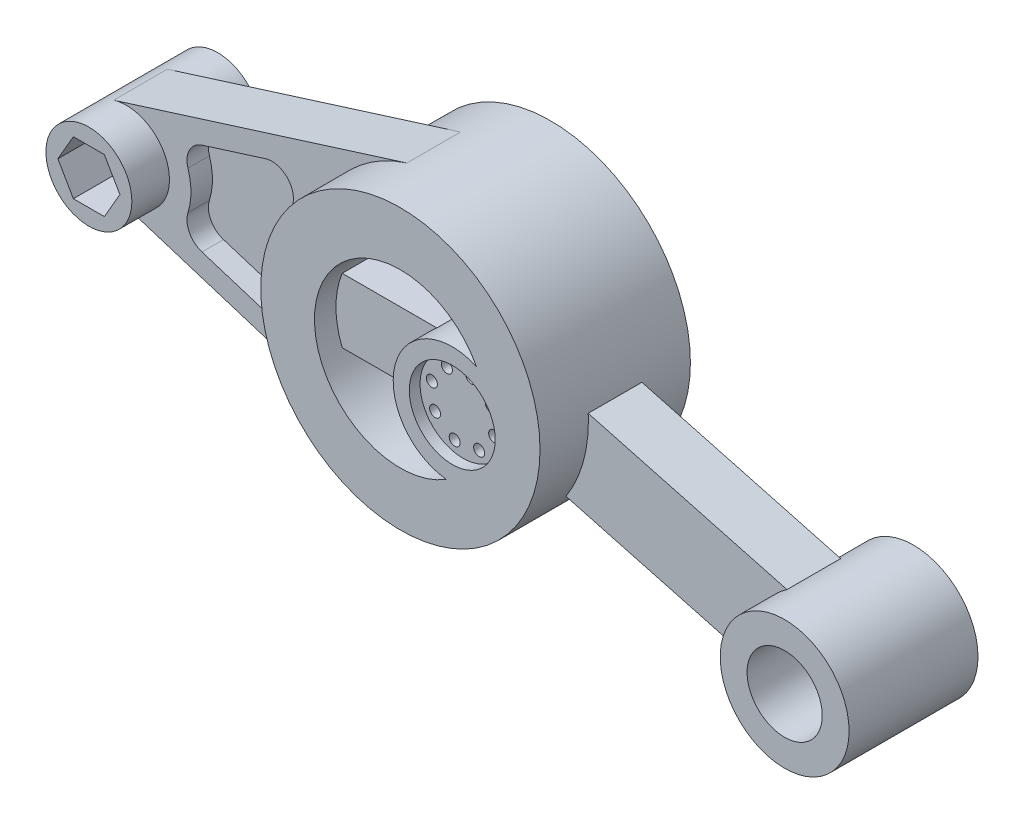
from build123d import *
from build123d.topology import SkipClean

# Parameters (mm, degrees)
LEFT_ARM_DEPTH                = 12.5
SKETCH2_R                     = 20
LEFT_BOSS_DEPTH               = 30
LEFT_HEX_DEPTH                = 233.486558751
LEFT_HEX_DEPTH_BACK           = 233.486558751
SKETCH3_R                     = 65
CENTRE_BOSS_DEPTH             = 35
SKETCH5_W                     = 25
SKETCH5_H                     = 40
RIGHT_ARM_DEPTH               = 180
SKETCH7_R                     = 30
RIGHT_BOSS_DEPTH              = 30
SKETCH8_R                     = 17.5
RIGHT_BOSS_HOLE_DEPTH         = 368.848119787
SKETCH9_R                     = 40
CENTRE_HOLE_DEPTH             = 369.764476639
SKETCH10_R                    = 27.5
CENTRE_BLOB_DEPTH             = 35
CENTRE_BEAM_REACH             = 222.573
SKETCH11_W                    = 50
SKETCH11_H                    = 30
CENTRE_BEAM_DIRECTION_2_REACH = 222.573
SKETCH12_R                    = 20
CUT_EXTRUDE4_DEPTH            = 5
F_1_4_20_TAPPED_HOLE1_D       = 5.1054
CIRPATTERN1_COUNT             = 8
CUT_OUT_DEPTH                 = 10
FILLET1_R                     = 10
FILLET1_OF_MIRROR2_R          = 10


with BuildPart() as part:
    # Sketch1 → LEFT_ARM (new, symmetric)
    with BuildSketch(Plane.XY):
        with BuildLine():
            Line((-6, 19.078784028), (130.5, 62.006048092))
            ThreePointArc((130.5, 62.006048092), (215, 0), (130.5, -62.006048092))
            Line((130.5, -62.006048092), (-6, -19.078784028))
            ThreePointArc((-6, -19.078784028), (-20, 0), (-6, 19.078784028))
        make_face()
    extrude(amount=LEFT_ARM_DEPTH, both=True)

    # Sketch2 → LEFT_Boss (add, symmetric)
    with SkipClean():  # the faces are left unmerged after this step: merging them gives an invalid solid
        with BuildSketch(Plane.XY):
            Circle(SKETCH2_R)
        extrude(amount=LEFT_BOSS_DEPTH, both=True)

    # Sketch4 → LEFT_Hex (cut, two sides: drawn at the far end of the back side and taken through both)
    with SkipClean():  # the faces are left unmerged after this step: merging them gives an invalid solid
        with BuildSketch(Plane.XY.offset(30).offset(-LEFT_HEX_DEPTH_BACK)):
            Polygon((14.43375673, 0), (7.216878365, 12.5), (-7.216878365, 12.5), (-14.43375673, 0), (-7.216878365, -12.5), (7.216878365, -12.5), align=None)
        extrude(amount=LEFT_HEX_DEPTH + LEFT_HEX_DEPTH_BACK, mode=Mode.SUBTRACT)

    # Sketch3 → CENTRE_Boss (add, symmetric)
    with SkipClean():  # the faces are left unmerged after this step: merging them gives an invalid solid
        with BuildSketch(Plane.XY):
            with Locations((150, 0)):
                Circle(SKETCH3_R)
        extrude(amount=CENTRE_BOSS_DEPTH, both=True)

    # Sketch5 → RIGHT_ARM (add)
    with SkipClean():  # the faces are left unmerged after this step: merging them gives an invalid solid
        with BuildSketch(Plane(origin=(139.951905284, -37.5, 0), x_dir=(0, 0, -1), z_dir=(0.9659258262890681, -0.25881904510252135, 0))):
            with Locations((0, 38.822856765)):
                Rectangle(SKETCH5_W, SKETCH5_H)
        extrude(amount=RIGHT_ARM_DEPTH)

    # Sketch7 → RIGHT_Boss (add, symmetric)
    with SkipClean():  # the faces are left unmerged after this step: merging them gives an invalid solid
        with BuildSketch(Plane.XY):
            with Locations((323.866648732, -46.587428118)):
                Circle(SKETCH7_R)
        extrude(amount=RIGHT_BOSS_DEPTH, both=True)
    add(part.part.scale(1), mode=Mode.REPLACE)  # the faces are merged on a copy

    # Sketch8 → RIGHT_Boss_Hole (cut, through all)
    with BuildSketch(Plane.XY.offset(30)):
        with Locations((323.866648732, -46.587428118)):
            Circle(SKETCH8_R)
    extrude(amount=-RIGHT_BOSS_HOLE_DEPTH, mode=Mode.SUBTRACT)

    # Sketch9 → CENTRE_Hole (cut, through all)
    with BuildSketch(Plane.XY.offset(35)):
        with Locations((150, 0)):
            Circle(SKETCH9_R)
    extrude(amount=-CENTRE_HOLE_DEPTH, mode=Mode.SUBTRACT)

    # Sketch10 → CENTRE_Blob (add, symmetric)
    with SkipClean():  # the faces are left unmerged after this step: merging them gives an invalid solid
        with BuildSketch(Plane.XY):
            with Locations((174.148145657, -6.470476128)):
                Circle(SKETCH10_R)
        extrude(amount=CENTRE_BLOB_DEPTH, both=True)

    # Sketch11 → CENTRE_Beam (add, up to next)
    with BuildSketch(Plane(origin=(150, 0, 0), x_dir=(0, 0, -1), z_dir=(1, 0, 0)), mode=Mode.PRIVATE) as centre_beam_sk1:
        Rectangle(SKETCH11_W, SKETCH11_H)
    centre_beam_tool1 = extrude(centre_beam_sk1.sketch, amount=CENTRE_BEAM_REACH, mode=Mode.PRIVATE) - part.part
    add(centre_beam_tool1.solids().sort_by_distance((150, 0, 0))[0])

    # Sketch11 → CENTRE_Beam direction 2 (add, up to next)
    with BuildSketch(Plane(origin=(150, 0, 0), x_dir=(0, 0, -1), z_dir=(1, 0, 0)), mode=Mode.PRIVATE) as centre_beam_direction_2_sk1:
        Rectangle(SKETCH11_W, SKETCH11_H)
    centre_beam_direction_2_tool1 = extrude(centre_beam_direction_2_sk1.sketch, amount=-CENTRE_BEAM_DIRECTION_2_REACH, mode=Mode.PRIVATE) - part.part
    add(centre_beam_direction_2_tool1.solids().sort_by_distance((150, 0, 0))[0])

    # Sketch12 → Cut-Extrude4 (cut)
    with BuildSketch(Plane.XY.offset(35)):
        with Locations((174.148145657, -6.470476128)):
            Circle(SKETCH12_R)
    cut_extrude4 = extrude(amount=-CUT_EXTRUDE4_DEPTH, mode=Mode.SUBTRACT)

    # 1/4-20 Tapped Hole1 (through all)
    with Locations(Plane.XY.offset(30)):
        with Locations((159.659258263, -2.588190451)):
            f_1_4_20_tapped_hole1 = Hole(F_1_4_20_TAPPED_HOLE1_D / 2)

    # CirPattern1: 1/4-20 Tapped Hole1 ×8 about axis
    cirpattern1_axis = Axis((174.148145657, -6.470476128, 0), (0, 0, 1))
    for i in range(1, CIRPATTERN1_COUNT):
        add(f_1_4_20_tapped_hole1.rotate(cirpattern1_axis, i * 360 / CIRPATTERN1_COUNT), mode=Mode.SUBTRACT)

    # Mirror1: Cut-Extrude4 across plane
    add(cut_extrude4.mirror(Plane.XY), mode=Mode.SUBTRACT)

    # Sketch15 → Cut_OUT (cut)
    with BuildSketch(Plane.XY.offset(12.5)):
        with BuildLine():
            Line((84.858453972, 37.169597537), (23.981475126, 18.024673388))
            ThreePointArc((23.981475126, 18.024673388), (30, 0), (23.981475126, -18.024673388))
            Line((23.981475126, -18.024673388), (84.858453972, -37.169597537))
            ThreePointArc((84.858453972, -37.169597537), (75, 0), (84.858453972, 37.169597537))
        make_face()
    cut_out = extrude(amount=-CUT_OUT_DEPTH, mode=Mode.SUBTRACT)

    # Fillet1
    fillet1_edges = [part.edges().sort_by_distance(p)[0] for p in [
        (23.981475126, -18.024673388, 7.5),
        (23.981475126, 18.024673388, 7.5),
        (84.858453972, 37.169597537, 7.5),
        (84.858453972, -37.169597537, 7.5),
    ]]
    fillet(fillet1_edges, radius=FILLET1_R)

    # Mirror2: Cut_OUT across plane
    with SkipClean():  # the faces are left unmerged after this step: merging them gives an invalid solid
        add(cut_out.mirror(Plane.XY), mode=Mode.SUBTRACT)

    # Fillet1 of Mirror2
    fillet1_of_mirror2_edges = [part.edges().sort_by_distance(p)[0] for p in [
        (23.981475126, -18.024673388, -7.5),
        (23.981475126, 18.024673388, -7.5),
        (84.858453972, 37.169597537, -7.5),
        (84.858453972, -37.169597537, -7.5),
    ]]
    fillet(fillet1_of_mirror2_edges, radius=FILLET1_OF_MIRROR2_R)


solid = part.part
